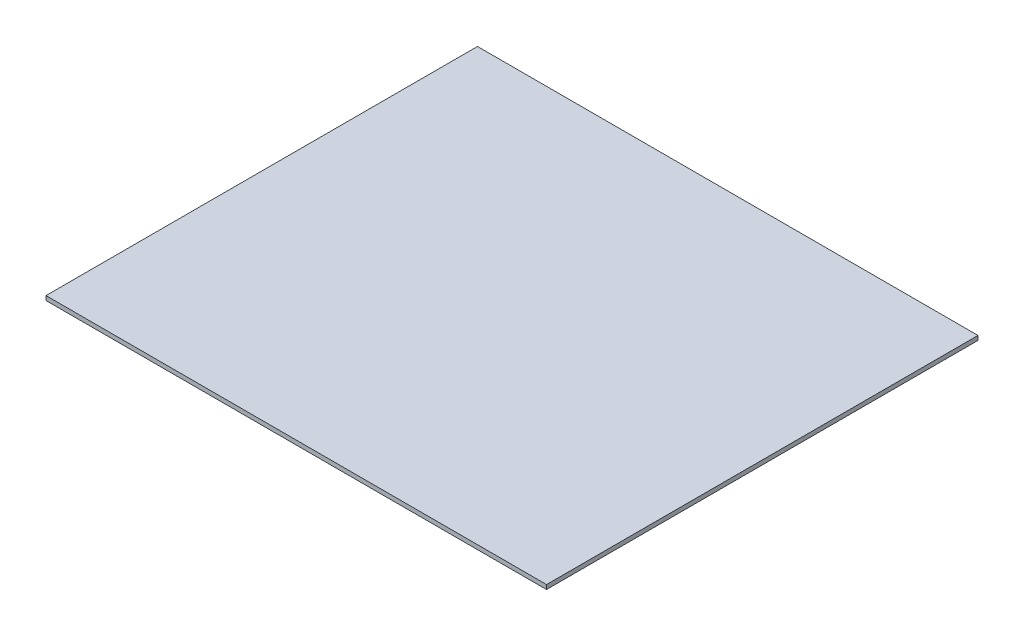
from build123d import *

# Parameters (mm, degrees)
SKETCH1_W           = 368.3
SKETCH1_H           = 317.5
BOSS_EXTRUDE1_DEPTH = 3.175


with BuildPart() as part:
    # Sketch1 → Boss-Extrude1 (new body)
    with BuildSketch(Plane(origin=(0, 0, 0), x_dir=(1, 0, 0), z_dir=(0, 1, 0))):
        Rectangle(SKETCH1_W, SKETCH1_H)
    extrude(amount=BOSS_EXTRUDE1_DEPTH)


solid = part.part
